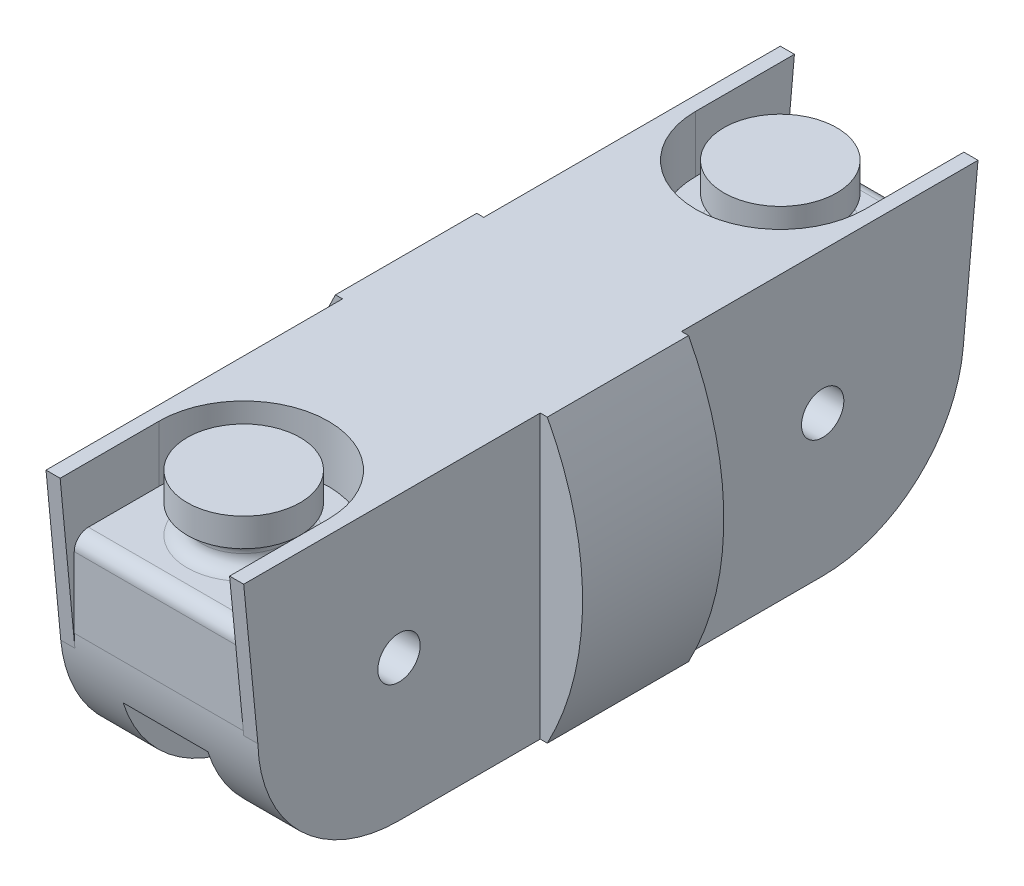
from build123d import *

# Parameters (mm, degrees)
SALIENTE_EXTRUIR1_DEPTH = 10
CROQUIS3_R              = 1.5
CORTAR_EXTRUIR1_DEPTH   = 10
SALIENTE_EXTRUIR2_DEPTH = 20
SALIENTE_EXTRUIR3_DEPTH = 20
CROQUIS6_R              = 1.5
CORTAR_EXTRUIR2_DEPTH   = 14
REDONDEO1_R             = 10
CUT_EXTRUDE1_DEPTH      = 4
SKETCH2_R               = 3
BOSS_EXTRUDE1_DEPTH     = 2
SKETCH3_R               = 4
BOSS_EXTRUDE2_DEPTH     = 2
FILLET1_R               = 1
FILLET2_R               = 1
FILLET3_R               = 1
BOSS_EXTRUDE3_DEPTH     = 1
BOSS_EXTRUDE4_DEPTH     = 1


with BuildPart() as part:
    # Croquis2 → Saliente-Extruir1 (new body)
    with BuildSketch(Plane.XY):
        with BuildLine():
            Line((-7.5, 10), (7.5, 10))
            ThreePointArc((7.5, 10), (10, 0), (7.5, -10))
            Line((7.5, -10), (-7.5, -10))
            ThreePointArc((-7.5, -10), (-10, 0), (-7.5, 10))
        make_face()
    extrude(amount=SALIENTE_EXTRUIR1_DEPTH)

    # Croquis3 → Cortar-Extruir1 (cut)
    with BuildSketch(Plane(origin=(0, 0, 0), x_dir=(-1, 0, 0), z_dir=(0, 0, -1))):
        with Locations((0, -7)):
            Circle(CROQUIS3_R)
    extrude(amount=-CORTAR_EXTRUIR1_DEPTH, mode=Mode.SUBTRACT)

    # Croquis4 → Saliente-Extruir2 (add)
    with BuildSketch(Plane(origin=(0, 0, 0), x_dir=(-1, 0, 0), z_dir=(0, 0, -1))):
        Polygon((-7, 10), (-7, -10), (-3, -10), (-3, -3), (3, -3), (3, -10), (7, -10), (7, 10), align=None)
    extrude(amount=SALIENTE_EXTRUIR2_DEPTH)

    # Croquis5 → Saliente-Extruir3 (add)
    with BuildSketch(Plane.XY.offset(10)):
        Polygon((-7, 10), (-7, -10), (-3, -10), (-3, -3), (3, -3), (3, -10), (7, -10), (7, 10), align=None)
    extrude(amount=SALIENTE_EXTRUIR3_DEPTH)

    # Croquis6 → Cortar-Extruir2 (cut)
    with BuildSketch(Plane(origin=(7, 0, 0), x_dir=(0, 0, -1), z_dir=(1, 0, 0))):
        with Locations((-20, 0)):
            Circle(CROQUIS6_R)
        with Locations((10, 0)):
            Circle(CROQUIS6_R)
    extrude(amount=-CORTAR_EXTRUIR2_DEPTH, mode=Mode.SUBTRACT)

    # Redondeo1
    redondeo1_edges = [part.edges().sort_by_distance(p)[0] for p in [
        (-5, -10, 30),
        (-5, -10, -20),
    ]]
    fillet(redondeo1_edges, radius=REDONDEO1_R)

    # Sketch1 → Cut-Extrude1 (cut)
    with BuildSketch(Plane(origin=(0, 10, 0), x_dir=(1, 0, 0), z_dir=(0, 1, 0))):
        with BuildLine():
            Line((-6, 14), (-6, 20))
            Line((-6, 20), (6, 20))
            Line((6, 20), (6, 14))
            ThreePointArc((6, 14), (0, 8), (-6, 14))
        make_face()
        with BuildLine():
            Line((-6, -24), (-6, -30))
            Line((-6, -30), (6, -30))
            Line((6, -30), (6, -24))
            ThreePointArc((6, -24), (0, -18), (-6, -24))
        make_face()
    extrude(amount=-CUT_EXTRUDE1_DEPTH, mode=Mode.SUBTRACT)

    # Sketch2 → Boss-Extrude1 (add)
    with BuildSketch(Plane(origin=(0, 6, 0), x_dir=(1, 0, 0), z_dir=(0, 1, 0))):
        with Locations(Location((0, 14, 0), (0, 0, 270))):
            Circle(SKETCH2_R)
        with Locations(Location((0, -24, 0), (0, 0, 270))):
            Circle(SKETCH2_R)
    extrude(amount=BOSS_EXTRUDE1_DEPTH)

    # Sketch3 → Boss-Extrude2 (add)
    with BuildSketch(Plane(origin=(0, 8, 0), x_dir=(1, 0, 0), z_dir=(0, 1, 0))):
        with Locations(Location((0, -24, 0), (0, 0, 270))):
            Circle(SKETCH3_R)
        with Locations(Location((0, 14, 0), (0, 0, 270))):
            Circle(SKETCH3_R)
    extrude(amount=BOSS_EXTRUDE2_DEPTH)

    # Fillet1
    fillet1_edges = [part.edges().sort_by_distance(p)[0] for p in [
        (0, 6, -17),
        (0, 8, -17),
        (0, 6, 21),
        (0, 8, 21),
    ]]
    fillet(fillet1_edges, radius=FILLET1_R - 0.0001)  # a hair under: the kernel refuses the full size

    # Fillet2
    fillet2_edges = [part.edges().sort_by_distance(p)[0] for p in [
        (0, 6, -20),
        (0, 6, 30),
    ]]
    fillet(fillet2_edges, radius=FILLET2_R)

    # Fillet3
    fillet3_edges = [part.edges().sort_by_distance(p)[0] for p in [
        (1.5, -7, 10),
        (1.5, -7, 0),
    ]]
    fillet(fillet3_edges, radius=FILLET3_R)

    # Sketch4 → Boss-Extrude3 (add)
    with BuildSketch(Plane(origin=(7, 0, 0), x_dir=(0, 0, -1), z_dir=(1, 0, 0))):
        Polygon((20, 10), (21, 10), (19.95475361, -0.950200281), align=None)
        Polygon((-30, 10), (-31, 10), (-29.862558585, -1.652252452), align=None)
    extrude(amount=-BOSS_EXTRUDE3_DEPTH)

    # Sketch5 → Boss-Extrude4 (add)
    with BuildSketch(Plane.ZY.offset(7)):
        Polygon((30, 10), (31, 10), (29.95475361, -0.950200281), align=None)
        Polygon((-20, 10), (-21, 10), (-19.95475361, -0.950200281), align=None)
    extrude(amount=-BOSS_EXTRUDE4_DEPTH)


solid = part.part
